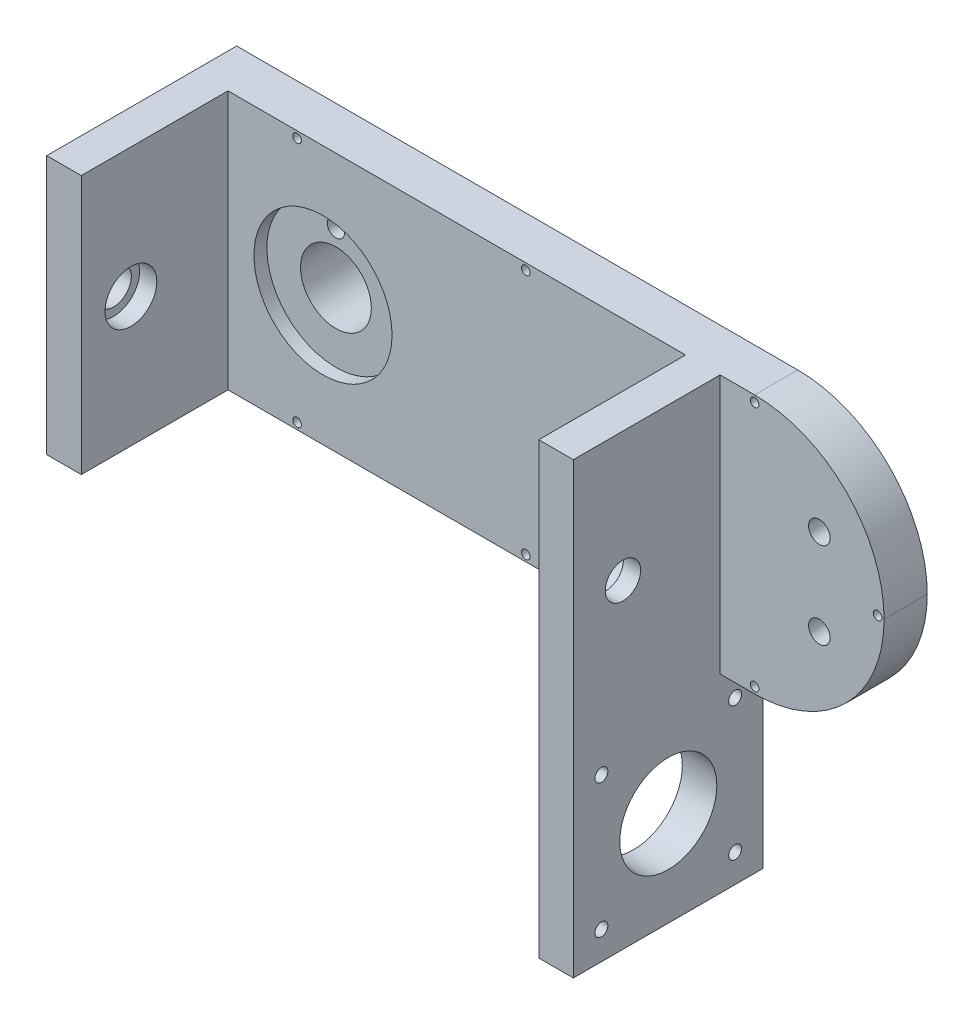
from build123d import *

# Parameters (mm, degrees)
SKETCH1_W           = 160
SKETCH1_H           = 60
BOSS_EXTRUDE1_DEPTH = 5
SKETCH4_W           = 8
SKETCH4_H           = 60
BOSS_EXTRUDE3_DEPTH = 34
CUT_EXTRUDE2_REACH  = 133.548
SKETCH5_R           = 4.1
SKETCH6_R           = 10
BOSS_EXTRUDE4_DEPTH = 12
CUT_EXTRUDE3_REACH  = 104.157
SKETCH7_R           = 4.2
LPATTERN1_COUNT     = 2
LPATTERN1_PITCH     = 114
CUT_EXTRUDE4_REACH  = 183.218
SKETCH8_R           = 4.1
CUT_EXTRUDE5_REACH  = 93.957
SKETCH9_R           = 2.5
FILLET1_R           = 30
CUT_EXTRUDE7_REACH  = 93.957
SKETCH12_R          = 1
SKETCH15_R          = 16
CUT_EXTRUDE11_DEPTH = 3
SKETCH16_R          = 8.2
CUT_EXTRUDE12_DEPTH = 12
SKETCH17_R          = 2
CUT_EXTRUDE13_DEPTH = 3
SKETCH18_W          = 8
SKETCH18_H          = 44
BOSS_EXTRUDE5_DEPTH = 44
CUT_EXTRUDE15_REACH = 149.922
SKETCH20_R          = 1.5
SKETCH20_R_2        = 11.25
SKETCH21_R          = 6
CUT_EXTRUDE16_DEPTH = 4
CUT_EXTRUDE17_START = -4
SKETCH22_R          = 6
CUT_EXTRUDE17_DEPTH = 4


with BuildPart() as part:
    # Sketch1 → Boss-Extrude1 (new, symmetric)
    with BuildSketch(Plane.XY):
        Rectangle(SKETCH1_W, SKETCH1_H)
    extrude(amount=BOSS_EXTRUDE1_DEPTH, both=True)

    # Sketch4 → Boss-Extrude3 (add)
    with BuildSketch(Plane.XY.offset(5)):
        with Locations((38, 0)):
            Rectangle(SKETCH4_W, SKETCH4_H)
    boss_extrude3 = extrude(amount=BOSS_EXTRUDE3_DEPTH)

    # Sketch5 → Cut-Extrude2 (cut, up to next)
    with BuildSketch(Plane(origin=(42, 0, 0), x_dir=(0, 0, -1), z_dir=(1, 0, 0)), mode=Mode.PRIVATE) as cut_extrude2_sk1:
        with Locations(Location((-27.5, 0, 0), (0, 0, 90))):
            Circle(SKETCH5_R)
    cut_extrude2_tool1 = extrude(cut_extrude2_sk1.sketch, amount=-CUT_EXTRUDE2_REACH, mode=Mode.PRIVATE) & part.part
    add(cut_extrude2_tool1.solids().sort_by_distance((42, 0, 27.5))[0], mode=Mode.SUBTRACT)

    # Sketch6 → Boss-Extrude4 (add)
    with BuildSketch(Plane(origin=(0, 0, -5), x_dir=(-1, 0, 0), z_dir=(0, 0, -1))):
        with Locations(Location((50, 0, 0), (0, 0, 180))):
            Circle(SKETCH6_R)
    extrude(amount=BOSS_EXTRUDE4_DEPTH)

    # Sketch7 → Cut-Extrude3 (cut, up to next)
    with BuildSketch(Plane(origin=(0, 0, -17), x_dir=(-1, 0, 0), z_dir=(0, 0, -1)), mode=Mode.PRIVATE) as cut_extrude3_sk1:
        with Locations((50, 0)):
            Circle(SKETCH7_R)
    cut_extrude3_tool1 = extrude(cut_extrude3_sk1.sketch, amount=-CUT_EXTRUDE3_REACH, mode=Mode.PRIVATE) & part.part
    add(cut_extrude3_tool1.solids().sort_by_distance((-50, 0, -17))[0], mode=Mode.SUBTRACT)

    # LPattern1: Boss-Extrude3 ×2
    with Locations(*[(-i * LPATTERN1_PITCH, 0, 0) for i in range(1, LPATTERN1_COUNT)]):
        add(boss_extrude3)

    # Sketch8 → Cut-Extrude4 (cut, up to next)
    with BuildSketch(Plane(origin=(-72, 0, -55), x_dir=(0, 0, -1), z_dir=(1, 0, 0)), mode=Mode.PRIVATE) as cut_extrude4_sk1:
        with Locations(Location((-82.5, 0, 0), (0, 0, 90))):
            Circle(SKETCH8_R)
    cut_extrude4_tool1 = extrude(cut_extrude4_sk1.sketch, amount=-CUT_EXTRUDE4_REACH, mode=Mode.PRIVATE) & part.part
    add(cut_extrude4_tool1.solids().sort_by_distance((-72, 0, 27.5))[0], mode=Mode.SUBTRACT)

    # Sketch9 → Cut-Extrude5 (cut, up to next)
    with BuildSketch(Plane.XY.offset(5), mode=Mode.PRIVATE) as cut_extrude5_sk1:
        with Locations((65, 10)):
            Circle(SKETCH9_R)
    cut_extrude5_tool1 = extrude(cut_extrude5_sk1.sketch, amount=-CUT_EXTRUDE5_REACH, mode=Mode.PRIVATE) & part.part
    # Sketch9 → Cut-Extrude5 (cut, up to next)
    with BuildSketch(Plane.XY.offset(5), mode=Mode.PRIVATE) as cut_extrude5_sk2:
        with Locations((65, -10)):
            Circle(SKETCH9_R)
    cut_extrude5_tool2 = extrude(cut_extrude5_sk2.sketch, amount=-CUT_EXTRUDE5_REACH, mode=Mode.PRIVATE) & part.part
    add(cut_extrude5_tool1.solids().sort_by_distance((65, 10, 5))[0], mode=Mode.SUBTRACT)
    add(cut_extrude5_tool2.solids().sort_by_distance((65, -10, 5))[0], mode=Mode.SUBTRACT)

    # Fillet1
    fillet1_edges = [part.edges().sort_by_distance(p)[0] for p in [
        (80, 30, 0),
        (80, -30, 0),
    ]]
    fillet(fillet1_edges, radius=FILLET1_R - 0.0001)  # a hair under: the kernel refuses the full size

    # Sketch12 → Cut-Extrude7 (cut, up to next)
    with BuildSketch(Plane.XY.offset(5), mode=Mode.PRIVATE) as cut_extrude7_sk1:
        with Locations((-3, 28.5)):
            Circle(SKETCH12_R)
    cut_extrude7_tool1 = extrude(cut_extrude7_sk1.sketch, amount=-CUT_EXTRUDE7_REACH, mode=Mode.PRIVATE) & part.part
    # Sketch12 → Cut-Extrude7 (cut, up to next)
    with BuildSketch(Plane.XY.offset(5), mode=Mode.PRIVATE) as cut_extrude7_sk2:
        with Locations((-56, 28.5)):
            Circle(SKETCH12_R)
    cut_extrude7_tool2 = extrude(cut_extrude7_sk2.sketch, amount=-CUT_EXTRUDE7_REACH, mode=Mode.PRIVATE) & part.part
    # Sketch12 → Cut-Extrude7 (cut, up to next)
    with BuildSketch(Plane.XY.offset(5), mode=Mode.PRIVATE) as cut_extrude7_sk3:
        with Locations((78.5, 0)):
            Circle(SKETCH12_R)
    cut_extrude7_tool3 = extrude(cut_extrude7_sk3.sketch, amount=-CUT_EXTRUDE7_REACH, mode=Mode.PRIVATE) & part.part
    # Sketch12 → Cut-Extrude7 (cut, up to next)
    with BuildSketch(Plane.XY.offset(5), mode=Mode.PRIVATE) as cut_extrude7_sk4:
        with Locations((50, 28.5)):
            Circle(SKETCH12_R)
    cut_extrude7_tool4 = extrude(cut_extrude7_sk4.sketch, amount=-CUT_EXTRUDE7_REACH, mode=Mode.PRIVATE) & part.part
    # Sketch12 → Cut-Extrude7 (cut, up to next)
    with BuildSketch(Plane.XY.offset(5), mode=Mode.PRIVATE) as cut_extrude7_sk5:
        with Locations((-3, -28.5)):
            Circle(SKETCH12_R)
    cut_extrude7_tool5 = extrude(cut_extrude7_sk5.sketch, amount=-CUT_EXTRUDE7_REACH, mode=Mode.PRIVATE) & part.part
    # Sketch12 → Cut-Extrude7 (cut, up to next)
    with BuildSketch(Plane.XY.offset(5), mode=Mode.PRIVATE) as cut_extrude7_sk6:
        with Locations((-56, -28.5)):
            Circle(SKETCH12_R)
    cut_extrude7_tool6 = extrude(cut_extrude7_sk6.sketch, amount=-CUT_EXTRUDE7_REACH, mode=Mode.PRIVATE) & part.part
    # Sketch12 → Cut-Extrude7 (cut, up to next)
    with BuildSketch(Plane.XY.offset(5), mode=Mode.PRIVATE) as cut_extrude7_sk7:
        with Locations((50, -28.5)):
            Circle(SKETCH12_R)
    cut_extrude7_tool7 = extrude(cut_extrude7_sk7.sketch, amount=-CUT_EXTRUDE7_REACH, mode=Mode.PRIVATE) & part.part
    add(cut_extrude7_tool1.solids().sort_by_distance((-3, 28.5, 5))[0], mode=Mode.SUBTRACT)
    add(cut_extrude7_tool2.solids().sort_by_distance((-56, 28.5, 5))[0], mode=Mode.SUBTRACT)
    add(cut_extrude7_tool3.solids().sort_by_distance((78.5, 0, 5))[0], mode=Mode.SUBTRACT)
    add(cut_extrude7_tool4.solids().sort_by_distance((50, 28.5, 5))[0], mode=Mode.SUBTRACT)
    add(cut_extrude7_tool5.solids().sort_by_distance((-3, -28.5, 5))[0], mode=Mode.SUBTRACT)
    add(cut_extrude7_tool6.solids().sort_by_distance((-56, -28.5, 5))[0], mode=Mode.SUBTRACT)
    add(cut_extrude7_tool7.solids().sort_by_distance((50, -28.5, 5))[0], mode=Mode.SUBTRACT)

    # Sketch15 → Cut-Extrude11 (cut)
    with BuildSketch(Plane.XY.offset(5)):
        with Locations((-50, 0)):
            Circle(SKETCH15_R)
    extrude(amount=-CUT_EXTRUDE11_DEPTH, mode=Mode.SUBTRACT)

    # Sketch16 → Cut-Extrude12 (cut)
    with BuildSketch(Plane.XY.offset(2)):
        with Locations((-50, 0)):
            Circle(SKETCH16_R)
    extrude(amount=-CUT_EXTRUDE12_DEPTH, mode=Mode.SUBTRACT)

    # Sketch17 → Cut-Extrude13 (cut)
    with BuildSketch(Plane.XY.offset(2)):
        with Locations((-50, 12)):
            Circle(SKETCH17_R)
        with Locations((-38, 15)):
            Circle(SKETCH17_R)
        with Locations((-35, 3)):
            Circle(SKETCH17_R)
        with Locations((-47, 0)):
            Circle(SKETCH17_R)
    extrude(amount=-CUT_EXTRUDE13_DEPTH, mode=Mode.SUBTRACT)

    # Sketch18 → Boss-Extrude5 (add)
    with BuildSketch(Plane(origin=(0, -30, 0), x_dir=(1, 0, 0), z_dir=(0, 1, 0))):
        with Locations((38, -17)):
            Rectangle(SKETCH18_W, SKETCH18_H)
    extrude(amount=-BOSS_EXTRUDE5_DEPTH)

    # Sketch20 → Cut-Extrude15 (cut, up to next)
    with BuildSketch(Plane(origin=(42, 0, 0), x_dir=(0, 0, -1), z_dir=(1, 0, 0)), mode=Mode.PRIVATE) as cut_extrude15_sk1:
        with Locations((-32.5, -36.5)):
            Circle(SKETCH20_R)
    cut_extrude15_tool1 = extrude(cut_extrude15_sk1.sketch, amount=-CUT_EXTRUDE15_REACH, mode=Mode.PRIVATE) & part.part
    # Sketch20 → Cut-Extrude15 (cut, up to next)
    with BuildSketch(Plane(origin=(42, 0, 0), x_dir=(0, 0, -1), z_dir=(1, 0, 0)), mode=Mode.PRIVATE) as cut_extrude15_sk2:
        with Locations((-1.5, -36.5)):
            Circle(SKETCH20_R)
    cut_extrude15_tool2 = extrude(cut_extrude15_sk2.sketch, amount=-CUT_EXTRUDE15_REACH, mode=Mode.PRIVATE) & part.part
    # Sketch20 → Cut-Extrude15 (cut, up to next)
    with BuildSketch(Plane(origin=(42, 0, 0), x_dir=(0, 0, -1), z_dir=(1, 0, 0)), mode=Mode.PRIVATE) as cut_extrude15_sk3:
        with Locations((-1.5, -67.5)):
            Circle(SKETCH20_R)
    cut_extrude15_tool3 = extrude(cut_extrude15_sk3.sketch, amount=-CUT_EXTRUDE15_REACH, mode=Mode.PRIVATE) & part.part
    # Sketch20 → Cut-Extrude15 (cut, up to next)
    with BuildSketch(Plane(origin=(42, 0, 0), x_dir=(0, 0, -1), z_dir=(1, 0, 0)), mode=Mode.PRIVATE) as cut_extrude15_sk4:
        with Locations((-32.5, -67.5)):
            Circle(SKETCH20_R)
    cut_extrude15_tool4 = extrude(cut_extrude15_sk4.sketch, amount=-CUT_EXTRUDE15_REACH, mode=Mode.PRIVATE) & part.part
    # Sketch20 → Cut-Extrude15 (cut, up to next)
    with BuildSketch(Plane(origin=(42, 0, 0), x_dir=(0, 0, -1), z_dir=(1, 0, 0)), mode=Mode.PRIVATE) as cut_extrude15_sk5:
        with Locations((-17, -52)):
            Circle(SKETCH20_R_2)
    cut_extrude15_tool5 = extrude(cut_extrude15_sk5.sketch, amount=-CUT_EXTRUDE15_REACH, mode=Mode.PRIVATE) & part.part
    add(cut_extrude15_tool1.solids().sort_by_distance((42, -36.5, 32.5))[0], mode=Mode.SUBTRACT)
    add(cut_extrude15_tool2.solids().sort_by_distance((42, -36.5, 1.5))[0], mode=Mode.SUBTRACT)
    add(cut_extrude15_tool3.solids().sort_by_distance((42, -67.5, 1.5))[0], mode=Mode.SUBTRACT)
    add(cut_extrude15_tool4.solids().sort_by_distance((42, -67.5, 32.5))[0], mode=Mode.SUBTRACT)
    add(cut_extrude15_tool5.solids().sort_by_distance((42, -52, 17))[0], mode=Mode.SUBTRACT)

    # Sketch21 → Cut-Extrude16 (cut)
    with BuildSketch(Plane(origin=(-72, 0, 0), x_dir=(0, 0, -1), z_dir=(1, 0, 0))):
        with Locations((-27.5, 0)):
            Circle(SKETCH21_R)
    extrude(amount=-CUT_EXTRUDE16_DEPTH, mode=Mode.SUBTRACT)

    # Sketch22 → Cut-Extrude17 (cut)
    with BuildSketch(Plane.ZY.offset(-34).offset(CUT_EXTRUDE17_START)):
        with Locations(Location((27.5, 0, 0), (0, 0, 180))):
            Circle(SKETCH22_R)
    extrude(amount=CUT_EXTRUDE17_DEPTH, mode=Mode.SUBTRACT)


solid = part.part
